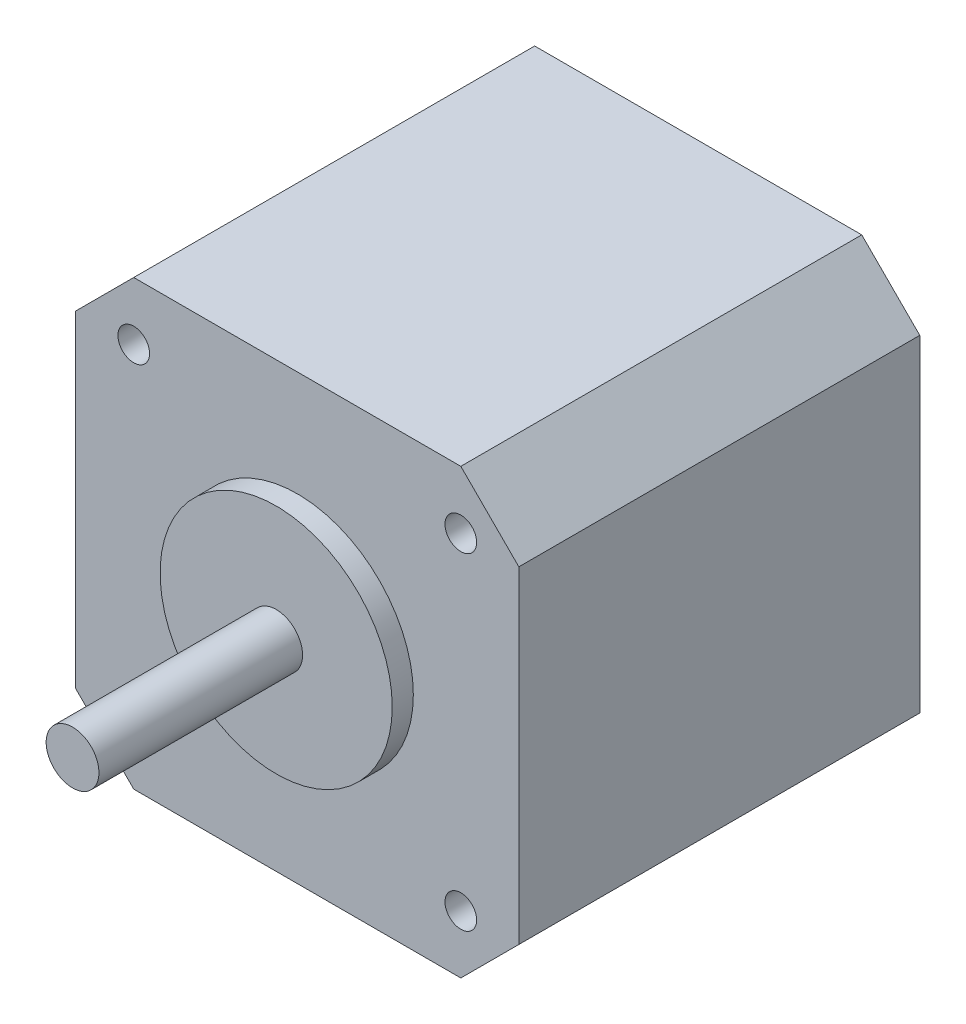
from build123d import *

# Parameters (mm, degrees)
BOSS_EXTRUDE1_DEPTH = 37.999924
SKETCH2_R           = 11.0000034
BOSS_EXTRUDE2_DEPTH = 2.00000108
SKETCH3_R           = 2.499995
BOSS_EXTRUDE3_DEPTH = 19.2999995
SKETCH4_R           = 1.499997
CUT_EXTRUDE1_DEPTH  = 3.999992


with BuildPart() as part:
    # Sketch1 → Boss-Extrude1 (new body)
    with BuildSketch(Plane.XY):
        Polygon((-20.999958, -15.499969), (-15.499969, -20.999958), (15.499969, -20.999958), (20.999958, -15.499969), (20.999958, 15.499969), (15.499969, 20.999958), (-15.499969, 20.999958), (-20.999958, 15.499969), align=None)
    extrude(amount=BOSS_EXTRUDE1_DEPTH)

    # Sketch2 → Boss-Extrude2 (add)
    with BuildSketch(Plane.XY.offset(37.999924)):
        Circle(SKETCH2_R)
    extrude(amount=BOSS_EXTRUDE2_DEPTH)

    # Sketch3 → Boss-Extrude3 (add)
    with BuildSketch(Plane.XY.offset(39.99992508)):
        Circle(SKETCH3_R)
    extrude(amount=BOSS_EXTRUDE3_DEPTH)

    # Sketch4 → Cut-Extrude1 (cut)
    with BuildSketch(Plane.XY.offset(37.999924)):
        with Locations((-15.499969, -15.499969)):
            Circle(SKETCH4_R)
        with Locations((15.499969, -15.499969)):
            Circle(SKETCH4_R)
        with Locations((-15.499969, 15.499969)):
            Circle(SKETCH4_R)
        with Locations((15.499969, 15.499969)):
            Circle(SKETCH4_R)
    extrude(amount=-CUT_EXTRUDE1_DEPTH, mode=Mode.SUBTRACT)


solid = part.part
